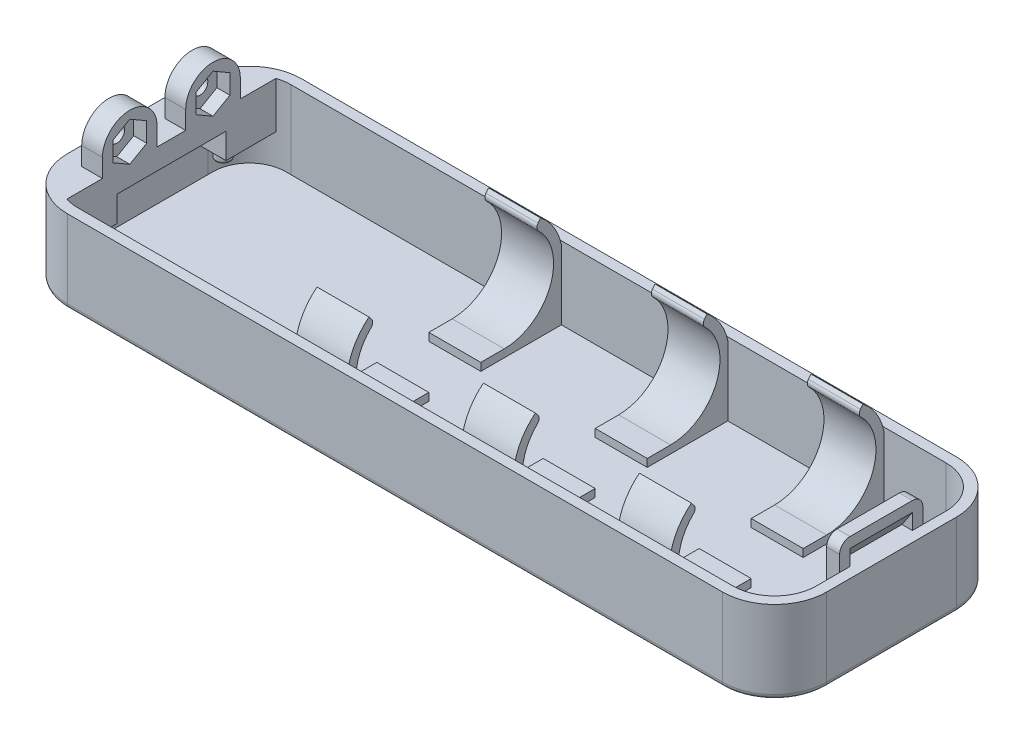
from build123d import *

# Parameters (mm, degrees)
BOSS_EXTRUDE1_DEPTH    = 2
BOSS_EXTRUDE2_DEPTH    = 14
FILLET1_R              = 1
SKETCH3_W              = 10
SKETCH3_H              = 41
BOSS_EXTRUDE3_DEPTH    = 25
BOSS_EXTRUDE5_DEPTH    = 12.75
CUT_EXTRUDE3_DEPTH     = 2.5
CUT_EXTRUDE5_OUTLINE_R = 1.5
CUT_EXTRUDE5_DEPTH     = 5.5
SKETCH10_W             = 2.5
SKETCH10_H             = 16
BOSS_EXTRUDE6_DEPTH    = 19
CUT_EXTRUDE6_DEPTH     = 12
FILLET2_R              = 2
CUT_EXTRUDE7_START     = -8.75
CUT_EXTRUDE7_DEPTH     = 8.75
CUT_EXTRUDE13_DEPTH    = 84
CUT_EXTRUDE15_DEPTH    = 2
BOSS_EXTRUDE7_START    = 4.9
BOSS_EXTRUDE7_DEPTH    = 4.9
SKETCH17_R             = 1.4
BOSS_EXTRUDE8_DEPTH    = 2
FILLET3_R              = 0.25
CUT_EXTRUDE16_START    = -42
CUT_EXTRUDE16_DEPTH    = 42
FILLET4_R              = 1


# Read off the part's stored shape, not the designer's step: Cut-Extrude5
with BuildPart() as part:
    # Sketch1 → Boss-Extrude1 (new body)
    with BuildSketch(Plane(origin=(0, 0, 0), x_dir=(1, 0, 0), z_dir=(0, 1, 0))):
        with BuildLine():
            Line((-10, 0), (-136, 0))
            ThreePointArc((-136, 0), (-143.071067812, -2.928932188), (-146, -10))
            Line((-146, -10), (-146, -35))
            ThreePointArc((-146, -35), (-143.071067812, -42.071067812), (-136, -45))
            Line((-136, -45), (-10, -45))
            ThreePointArc((-10, -45), (-2.928932188, -42.071067812), (0, -35))
            Line((0, -35), (0, -10))
            ThreePointArc((0, -10), (-2.928932188, -2.928932188), (-10, 0))
        make_face()
    extrude(amount=BOSS_EXTRUDE1_DEPTH)

    # Sketch2 → Boss-Extrude2 (add)
    with BuildSketch(Plane(origin=(0, 2, 0), x_dir=(1, 0, 0), z_dir=(0, 1, 0))):
        with BuildLine():
            Line((-10, 0), (-136, 0))
            ThreePointArc((-136, 0), (-143.071067812, -2.928932188), (-146, -10))
            Line((-146, -10), (-146, -35))
            ThreePointArc((-146, -35), (-143.071067812, -42.071067812), (-136, -45))
            Line((-136, -45), (-10, -45))
            ThreePointArc((-10, -45), (-2.928932188, -42.071067812), (0, -35))
            Line((0, -35), (0, -10))
            ThreePointArc((0, -10), (-2.928932188, -2.928932188), (-10, 0))
        make_face()
        with BuildLine():
            Line((-10, -2), (-136, -2))
            ThreePointArc((-136, -2), (-141.656854249, -4.343145751), (-144, -10))
            Line((-144, -10), (-144, -35))
            ThreePointArc((-144, -35), (-141.656854249, -40.656854249), (-136, -43))
            Line((-136, -43), (-10, -43))
            ThreePointArc((-10, -43), (-4.343145751, -40.656854249), (-2, -35))
            Line((-2, -35), (-2, -10))
            ThreePointArc((-2, -10), (-4.343145751, -4.343145751), (-10, -2))
        make_face(mode=Mode.SUBTRACT)
    extrude(amount=BOSS_EXTRUDE2_DEPTH)

    # Fillet1
    fillet1_edges = [part.edges().sort_by_distance(p)[0] for p in [
        (-73, 0, 0),
        (-2.928932188, 0, 2.928932188),
        (0, 0, 22.5),
        (-2.928932188, 0, 42.071067812),
        (-73, 0, 45),
        (-143.071067812, 0, 42.071067812),
        (-146, 0, 22.5),
        (-143.071067812, 0, 2.928932188),
    ]]
    fillet(fillet1_edges, radius=FILLET1_R)

    # Sketch3 → Boss-Extrude3 (add)
    with BuildSketch(Plane(origin=(0, 2, 0), x_dir=(1, 0, 0), z_dir=(0, 1, 0))):
        with Locations((-57, -22.5)):
            Rectangle(SKETCH3_W, SKETCH3_H)
        with Locations((-89, -22.5)):
            Rectangle(SKETCH3_W, SKETCH3_H)
        with Locations((-27, -22.5)):
            Rectangle(SKETCH3_W, SKETCH3_H)
    extrude(amount=BOSS_EXTRUDE3_DEPTH)

    # Sketch7 → Boss-Extrude5 (add)
    with BuildSketch(Plane(origin=(0, 12, 0), x_dir=(1, 0, 0), z_dir=(0, 1, 0))):
        with BuildLine():
            ThreePointArc((-138.5, -2.400657923), (-142.480740698, -5.30958424), (-144, -10))
            Line((-144, -10), (-144, -35))
            ThreePointArc((-144, -35), (-142.480740698, -39.69041576), (-138.5, -42.599342077))
            Line((-138.5, -42.599342077), (-138.5, -2.400657923))
        make_face()
    extrude(amount=BOSS_EXTRUDE5_DEPTH)

    # Sketch8 → Cut-Extrude3 (cut)
    with BuildSketch(Plane(origin=(-138.5, 0, 0), x_dir=(0, 0, -1), z_dir=(1, 0, 0))):
        Polygon((-27.25, 17.620834875), (-27.25, 21.373611625), (-30.5, 23.25), (-33.75, 21.373611625), (-33.75, 17.620834875), (-30.5, 15.744446501), align=None)
        Polygon((-11.25, 17.620834875), (-11.25, 21.373611625), (-14.5, 23.25), (-17.75, 21.373611625), (-17.75, 17.620834875), (-14.5, 15.744446501), align=None)
    extrude(amount=-CUT_EXTRUDE3_DEPTH, mode=Mode.SUBTRACT)

    # Cut-Extrude5 outline → Cut-Extrude5 (cut)
    with BuildSketch(Plane(origin=(-144, 0, 0), x_dir=(0, 0, -1), z_dir=(1, 0, 0))):
        with BuildLine():
            Line((-2.400657923, 24.75), (-14.500000003, 24.75))
            ThreePointArc((-14.500000003, 24.75), (-10.785725941, 23.211497311), (-9.24722325, 19.49722325))
            Line((-9.24722325, 19.49722325), (-9.24722325, 16))
            Line((-9.24722325, 16), (-2.400657923, 16))
            Line((-2.400657923, 16), (-2.400657923, 24.75))
        make_face()
        with BuildLine():
            ThreePointArc((-19.75277675, 19.49722325), (-18.214274061, 23.211497309), (-14.500000003, 24.75))
            Line((-14.500000003, 24.75), (-30.49999999, 24.75))
            ThreePointArc((-30.49999999, 24.75), (-26.785725937, 23.211497307), (-25.24722325, 19.49722325))
            Line((-25.24722325, 19.49722325), (-25.24722325, 16))
            Line((-25.24722325, 16), (-19.75277675, 16))
            Line((-19.75277675, 16), (-19.75277675, 19.49722325))
        make_face()
        with BuildLine():
            ThreePointArc((-35.75277675, 19.49722325), (-34.214274056, 23.211497313), (-30.49999999, 24.75))
            Line((-30.49999999, 24.75), (-42.599342077, 24.75))
            Line((-42.599342077, 24.75), (-42.599342077, 16))
            Line((-42.599342077, 16), (-35.75277675, 16))
            Line((-35.75277675, 16), (-35.75277675, 19.49722325))
        make_face()
        with Locations((-14.5, 19.49722325)):
            Circle(CUT_EXTRUDE5_OUTLINE_R)
        with Locations((-30.5, 19.49722325)):
            Circle(CUT_EXTRUDE5_OUTLINE_R)
    extrude(amount=CUT_EXTRUDE5_DEPTH, mode=Mode.SUBTRACT)

    # Sketch10 → Boss-Extrude6 (add)
    with BuildSketch(Plane(origin=(0, 2, 0), x_dir=(1, 0, 0), z_dir=(0, 1, 0))):
        with Locations((-3.25, -22.5)):
            Rectangle(SKETCH10_W, SKETCH10_H)
    extrude(amount=BOSS_EXTRUDE6_DEPTH)

    # Sketch11 → Cut-Extrude6 (cut)
    with BuildSketch(Plane(origin=(0, 0, 16.5), x_dir=(-1, 0, 0), z_dir=(0, 0, -1))):
        Polygon((2, 19), (4, 16), (2, 16), align=None)
    extrude(amount=-CUT_EXTRUDE6_DEPTH, mode=Mode.SUBTRACT)

    # Fillet2
    fillet2_edges = [part.edges().sort_by_distance(p)[0] for p in [
        (-3.25, 21, 14.5),
        (-3.25, 21, 30.5),
    ]]
    fillet(fillet2_edges, radius=FILLET2_R)

    # Sketch12 → Cut-Extrude7 (cut)
    with BuildSketch(Plane(origin=(0, 24.75, 0), x_dir=(1, 0, 0), z_dir=(0, 1, 0)).offset(CUT_EXTRUDE7_START)):
        with BuildLine():
            ThreePointArc((-143.964504201, -9.24722325), (-143.991121123, -9.623193423), (-144, -10))
            Line((-144, -10), (-144, -19.75277675))
            Line((-144, -19.75277675), (-142.5, -19.75277675))
            Line((-142.5, -19.75277675), (-142.5, -9.24722325))
            Line((-142.5, -9.24722325), (-143.964504201, -9.24722325))
        make_face()
        with BuildLine():
            ThreePointArc((-144, -35), (-143.991121123, -35.376806577), (-143.964504201, -35.75277675))
            Line((-143.964504201, -35.75277675), (-142.5, -35.75277675))
            Line((-142.5, -35.75277675), (-142.5, -25.24722325))
            Line((-142.5, -25.24722325), (-144, -25.24722325))
            Line((-144, -25.24722325), (-144, -35))
        make_face()
    extrude(amount=CUT_EXTRUDE7_DEPTH, mode=Mode.SUBTRACT)

    # Sketch4 → Cut-Extrude13 (cut)
    with BuildSketch(Plane.ZY.offset(22)):
        with BuildLine():
            Line((6, 21.806957477), (7.088888889, 20.436986314))
            ThreePointArc((7.088888889, 20.436986314), (4.030569417, 9.86961424), (13, 3.5))
            Line((13, 3.5), (17.5, 3.5))
            Line((17.5, 3.5), (17.5, 2))
            Line((17.5, 2), (27.5, 2))
            Line((27.5, 2), (27.5, 3.5))
            Line((27.5, 3.5), (32, 3.5))
            ThreePointArc((32, 3.5), (40.969430583, 9.86961424), (37.911111111, 20.436986314))
            Line((37.911111111, 20.436986314), (39, 21.806957477))
            ThreePointArc((39, 21.806957477), (41.560108062, 18.930163053), (43, 15.358495283))
            Line((43, 15.358495283), (43, 27))
            Line((43, 27), (2, 27))
            Line((2, 27), (2, 15.358495283))
            ThreePointArc((2, 15.358495283), (3.439891938, 18.930163053), (6, 21.806957477))
        make_face()
    extrude(amount=CUT_EXTRUDE13_DEPTH, mode=Mode.SUBTRACT)

    # Sketch15 → Cut-Extrude15 (cut)
    with BuildSketch(Plane.XZ):
        with BuildLine():
            Line((-136, 2), (-94, 2))
            Line((-94, 2), (-94, 3))
            Line((-94, 3), (-95, 3))
            Line((-95, 3), (-136, 3))
            ThreePointArc((-136, 3), (-140.949747468, 5.050252532), (-143, 10))
            Line((-143, 10), (-143, 35))
            ThreePointArc((-143, 35), (-140.949747468, 39.949747468), (-136, 42))
            Line((-136, 42), (-95, 42))
            Line((-95, 42), (-94, 42))
            Line((-94, 42), (-94, 43))
            Line((-94, 43), (-136, 43))
            ThreePointArc((-136, 43), (-141.656854249, 40.656854249), (-144, 35))
            Line((-144, 35), (-144, 10))
            ThreePointArc((-144, 10), (-141.656854249, 4.343145751), (-136, 2))
        make_face()
    extrude(amount=-CUT_EXTRUDE15_DEPTH, mode=Mode.SUBTRACT)

    # Sketch16 → Boss-Extrude7 (add)
    with BuildSketch(Plane.XZ.offset(-12).offset(BOSS_EXTRUDE7_START)):
        with BuildLine():
            Line((-144, 35), (-144, 33))
            Line((-144, 33), (-138.5, 33))
            Line((-138.5, 33), (-138.5, 42.599342077))
            ThreePointArc((-138.5, 42.599342077), (-142.480740698, 39.69041576), (-144, 35))
        make_face()
        with BuildLine():
            Line((-138.5, 12), (-144, 12))
            Line((-144, 12), (-144, 10))
            ThreePointArc((-144, 10), (-142.480740698, 5.30958424), (-138.5, 2.400657923))
            Line((-138.5, 2.400657923), (-138.5, 12))
        make_face()
    extrude(amount=-BOSS_EXTRUDE7_DEPTH)

    # Sketch17 → Boss-Extrude8 (add)
    with BuildSketch(Plane.XZ.offset(-7.1)):
        with Locations(Location((-141.25, 35.2, 0), (0, 0, 270))):
            Circle(SKETCH17_R)
        with Locations(Location((-141.25, 9.8, 0), (0, 0, 270))):
            Circle(SKETCH17_R)
    extrude(amount=BOSS_EXTRUDE8_DEPTH)

    # Fillet3
    fillet3_edges = [part.edges().sort_by_distance(p)[0] for p in [
        (-141.25, 5.1, 36.6),
        (-141.25, 5.1, 11.2),
    ]]
    fillet(fillet3_edges, radius=FILLET3_R)

    # Sketch19 → Cut-Extrude16 (cut)
    with BuildSketch(Plane.ZY.offset(94).offset(CUT_EXTRUDE16_START)):
        with BuildLine():
            Line((42, 5.72527161), (40.024254166, 7.914594894))
            ThreePointArc((40.024254166, 7.914594894), (39.435774802, 7.087364962), (38.762381995, 6.327654854))
            Line((38.762381995, 6.327654854), (40, 4.956250765))
            Line((40, 4.956250765), (40, 2.5))
            Line((40, 2.5), (42, 2.5))
            Line((42, 2.5), (42, 5.72527161))
        make_face()
    extrude(amount=CUT_EXTRUDE16_DEPTH, mode=Mode.SUBTRACT)

    # Fillet4
    fillet4_edges = [part.edges().sort_by_distance(p)[0] for p in [
        (-57, 20.436986314, 7.088888889),
        (-89, 20.436986314, 7.088888889),
        (-27, 20.436986314, 7.088888889),
        (-57, 20.436986314, 37.911111111),
        (-89, 20.436986314, 37.911111111),
        (-27, 20.436986314, 37.911111111),
    ]]
    fillet(fillet4_edges, radius=FILLET4_R)


solid = part.part
